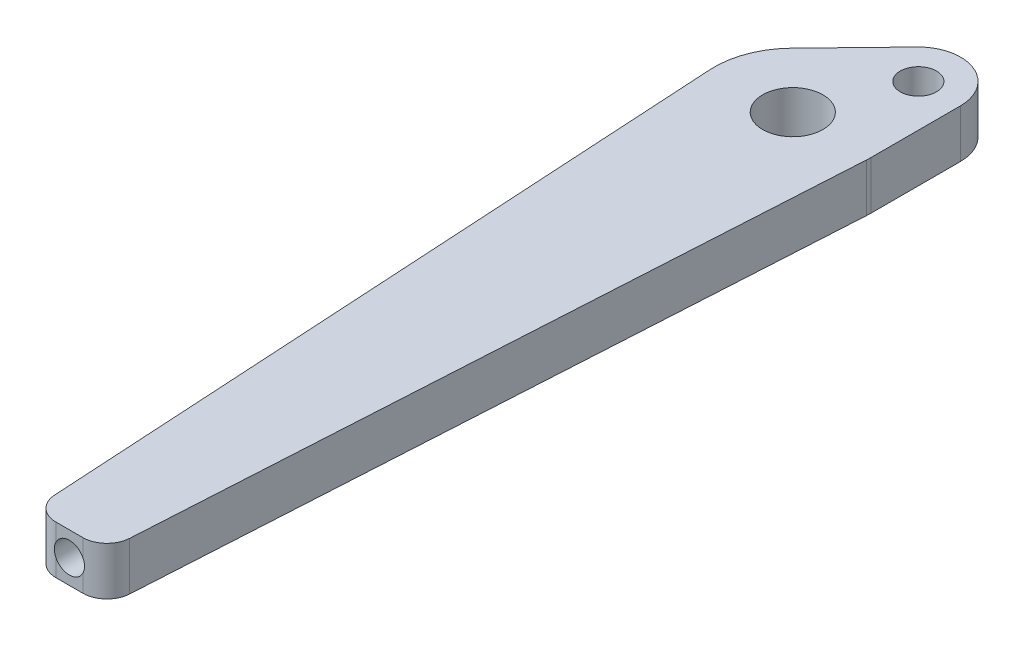
from build123d import *

# Parameters (mm, degrees)
SKETCH1_R                        = 3.175
SKETCH1_R_2                      = 1.905
BOSS_EXTRUDE1_DEPTH              = 5.08
F_1_8_0_125_DIAMETER_HOLE1_D     = 3.175
F_1_8_0_125_DIAMETER_HOLE1_DEPTH = 12.7
F_1_8_0_125_DIAMETER_HOLE1_TIP   = 0.953866233
FILLET1_R                        = 2.54


with BuildPart() as part:
    # Sketch1 → Boss-Extrude1 (new body)
    with BuildSketch(Plane(origin=(0, 0, 0), x_dir=(1, 0, 0), z_dir=(0, 1, 0))):
        with BuildLine():
            Line((-5.93328125, 5.73944236), (0.61515625, 12.509041042))
            ThreePointArc((0.61515625, 12.509041042), (5.476875, 13.539197363), (8.255, 9.418572079))
            Line((8.255, 9.418572079), (8.255, 0))
            ThreePointArc((8.255, 0), (8.251474709, -0.241226303), (8.240901846, -0.482246574))
            Line((8.240901846, -0.482246574), (3.81, -76.2))
            Line((3.81, -76.2), (-3.81, -76.2))
            Line((-3.81, -76.2), (-8.240901846, -0.482246574))
            ThreePointArc((-8.240901846, -0.482246574), (-7.739781645, 2.870680248), (-5.93328125, 5.73944236))
        make_face()
        with Locations(Location((0, 0, 0), (0, 0, 270))):
            Circle(SKETCH1_R, mode=Mode.SUBTRACT)
        with Locations(Location((3.81, 9.418572079, 0), (0, 0, 270))):
            Circle(SKETCH1_R_2, mode=Mode.SUBTRACT)
    extrude(amount=BOSS_EXTRUDE1_DEPTH)

    # 1/8 (0.125) Diameter Hole1
    with Locations(Plane.XY.offset(76.2)):
        with Locations((0, 2.54)):
            Hole(F_1_8_0_125_DIAMETER_HOLE1_D / 2, depth=F_1_8_0_125_DIAMETER_HOLE1_DEPTH)
            with Locations((0, 0, -(F_1_8_0_125_DIAMETER_HOLE1_DEPTH + F_1_8_0_125_DIAMETER_HOLE1_TIP / 2))):  # 118° drill point
                Cone(0, F_1_8_0_125_DIAMETER_HOLE1_D / 2, F_1_8_0_125_DIAMETER_HOLE1_TIP, mode=Mode.SUBTRACT)

    # Fillet1
    # the kernel refuses this fillet: 2.54 mm, written as the material it takes off along each edge
    with BuildSketch(Plane(origin=(3.81, -5.989269764, 76.2), x_dir=(0.05841872493617041, 0, -0.9982921679432489), z_dir=(0, 1, 0))) as fillet1_piece_1:
        with BuildLine():
            CenterArc((FILLET1_R * 0.943192088749, FILLET1_R), FILLET1_R, 183.349053141, 86.650946859)
            Line((-FILLET1_R * 0.0551000791946, FILLET1_R * 0.941581275064), (0, 0))
            Line((0, 0), (FILLET1_R * 0.943192088749, 0))
        make_face()
    extrude(amount=17.058539527, mode=Mode.SUBTRACT)
    with BuildSketch(Plane(origin=(-3.81, -5.989269764, 76.2), x_dir=(-0.05841872493617083, 0, -0.9982921679432489), z_dir=(0, 1, 0))) as fillet1_piece_2:
        with BuildLine():
            CenterArc((FILLET1_R * 0.943192088749, -FILLET1_R), FILLET1_R, 90, 86.650946859)
            Line((-FILLET1_R * 0.0551000791946, -FILLET1_R * 0.941581275064), (0, 0))
            Line((0, 0), (FILLET1_R * 0.943192088749, 0))
        make_face()
    extrude(amount=17.058539527, mode=Mode.SUBTRACT)


solid = part.part
